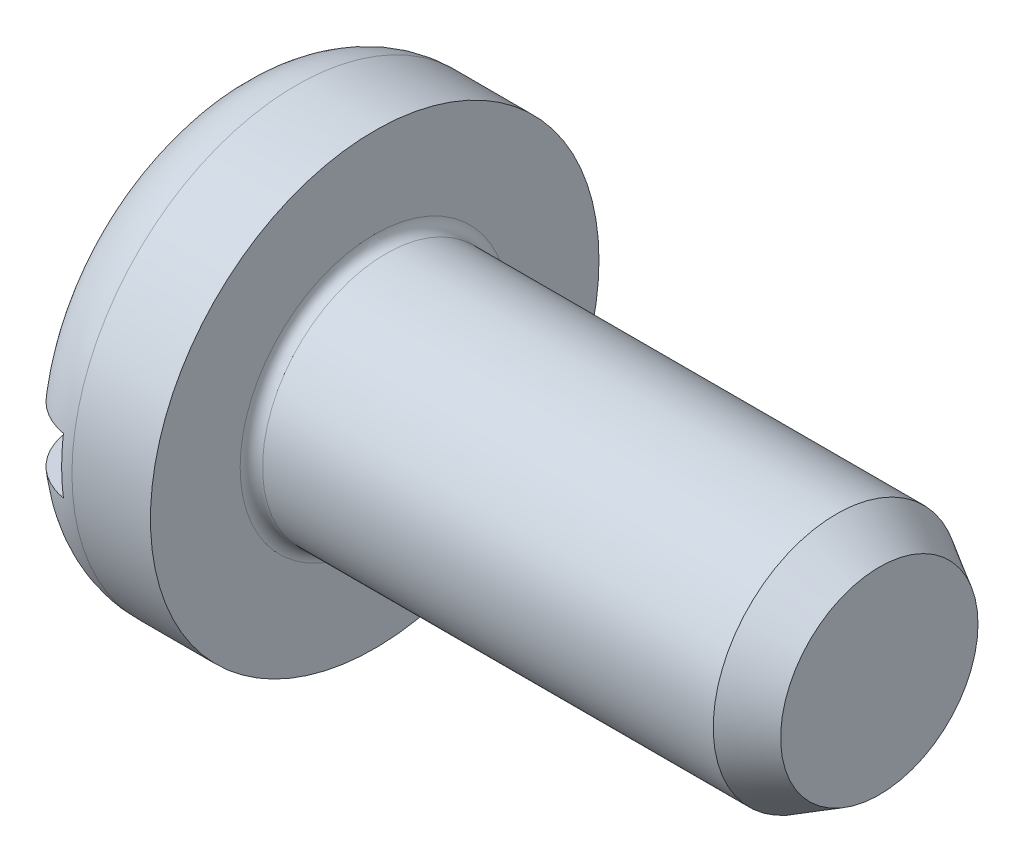
from build123d import *

# Parameters (mm, degrees)
CHAMFER1_SIZE  = 0.22
CHAMFER1_SIZE2 = 0.381051178
FILLET1_R      = 0.1
FILLET2_R      = 0.6
SKETCH7_W      = 1.5
SKETCH7_H      = 0.5
SLOT_DEPTH     = 15


with BuildPart() as part:
    # Sketch1 → Revolve1 (revolve)
    with BuildSketch(Plane.XY):
        Polygon((0, 0), (0, 2), (1.3, 2), (1.3, 1.1), (5.8, 1.1), (5.8, 0), align=None)
    revolve(axis=Axis((13.107885839, 0, 0), (-1, 0, 0)))

    # Chamfer1
    chamfer1_edges = [part.edges().sort_by_distance(p)[0] for p in [
        (5.8, -1.1, 0),
    ]]
    chamfer1_side = [part.faces().sort_by_distance(p)[0] for p in [
        (5.8, 0, 0),
    ]]
    chamfer(chamfer1_edges, length=CHAMFER1_SIZE, length2=CHAMFER1_SIZE2, reference=chamfer1_side[0])

    # Fillet1
    fillet1_edges = [part.edges().sort_by_distance(p)[0] for p in [
        (1.3, -1.1, 0),
    ]]
    fillet(fillet1_edges, radius=FILLET1_R)

    # Fillet2
    fillet2_edges = [part.edges().sort_by_distance(p)[0] for p in [
        (0, -2, 0),
    ]]
    fillet(fillet2_edges, radius=FILLET2_R)

    # Sketch7 → Slot (cut, symmetric)
    with BuildSketch(Plane.XY):
        with Locations((-0.25, 0)):
            Rectangle(SKETCH7_W, SKETCH7_H)
    extrude(amount=SLOT_DEPTH, both=True, mode=Mode.SUBTRACT)


solid = part.part
